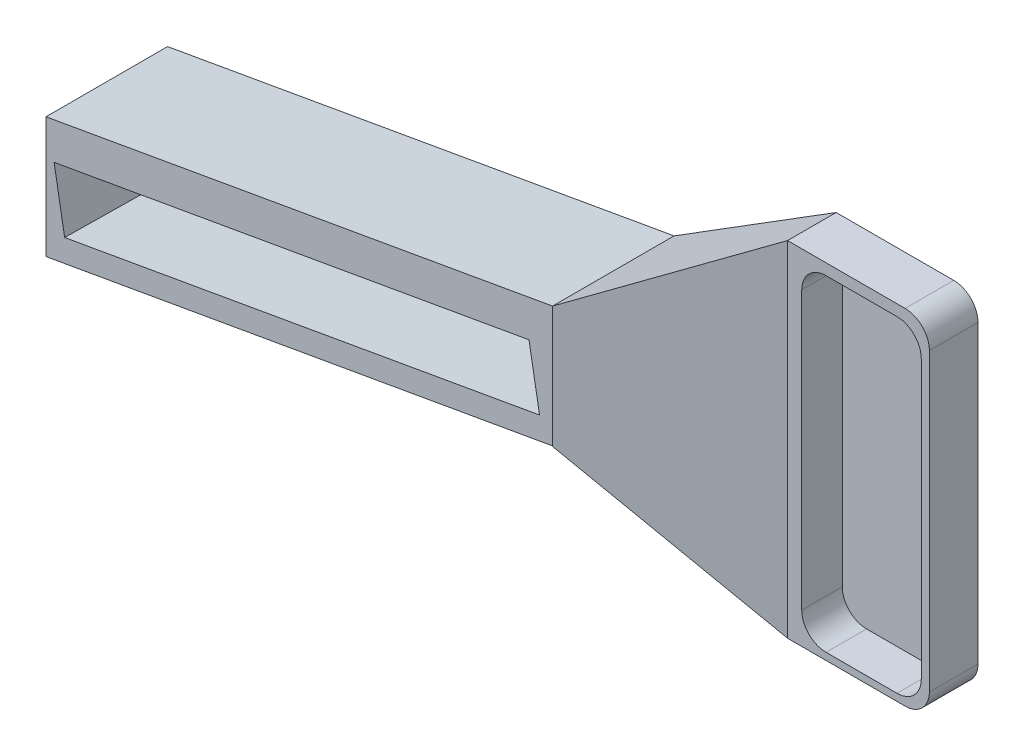
from build123d import *

# Parameters (mm, degrees)
ESQUISSE1_W              = 200
ESQUISSE1_H              = 85
BOSS_EXTRU_1_DEPTH       = 30
ENL_V_MAT_EXTRU_3_DEPTH  = 28
ESQUISSE3_W              = 35
ESQUISSE3_H              = 85
ENL_V_MAT_EXTRU_4_DEPTH  = 18
ESQUISSE4_W              = 29.5
ESQUISSE4_H              = 80.5
ENL_V_MAT_EXTRU_5_DEPTH  = 10
CHANFREIN1_SIZE2         = 40
CHANFREIN1_SIZE          = 18
ENL_V_MAT_EXTRU_18_DEPTH = 220.374109685
ENL_V_MAT_EXTRU_19_DEPTH = 220.374109685
CHANFREIN5_SIZE2         = 30
CHANFREIN5_SIZE          = 40
CHANFREIN6_SIZE2         = 25
CHANFREIN6_SIZE          = 40
ESQUISSE10_W             = 40
ESQUISSE10_H             = 2
ENL_V_MAT_EXTRU_20_DEPTH = 2
ENL_V_MAT_EXTRU_21_DEPTH = 4
CONG_6_R                 = 6
CONG_7_R                 = 6
CHANFREIN7_SIZE2         = 119
CHANFREIN7_SIZE          = 2
CHANFREIN8_SIZE          = 0.47
CHANFREIN8_SIZE_2        = 28


# Some blends are built 0.0001 mm under size
with BuildPart() as part:
    # Esquisse1 → Boss.-Extru.1 (new body)
    with BuildSketch(Plane.XY):
        with Locations((100, 42.5)):
            Rectangle(ESQUISSE1_W, ESQUISSE1_H)
    extrude(amount=BOSS_EXTRU_1_DEPTH)

    # Esquisse2 → Enlèv. mat.-Extru.3 (cut)
    with BuildSketch(Plane.XY.offset(30)):
        Polygon((119.192122608, 49.886058148), (121.796845273, 35.113941852), (4.604722665, 14.44980871), (2, 29.221925005), align=None)
    extrude(amount=-ENL_V_MAT_EXTRU_3_DEPTH, mode=Mode.SUBTRACT)

    # Esquisse3 → Enlèv. mat.-Extru.4 (cut)
    with BuildSketch(Plane.XY.offset(30)):
        with Locations((182.5, 42.5)):
            Rectangle(ESQUISSE3_W, ESQUISSE3_H)
    extrude(amount=-ENL_V_MAT_EXTRU_4_DEPTH, mode=Mode.SUBTRACT)

    # Esquisse4 → Enlèv. mat.-Extru.5 (cut)
    with BuildSketch(Plane.XY.offset(12)):
        with Locations((183.25, 42)):
            Rectangle(ESQUISSE4_W, ESQUISSE4_H)
    extrude(amount=-ENL_V_MAT_EXTRU_5_DEPTH, mode=Mode.SUBTRACT)

    # Chanfrein1
    chanfrein1_edges = [part.edges().sort_by_distance(p)[0] for p in [
        (165, 42.5, 30),
    ]]
    chanfrein1_side = [part.faces().sort_by_distance(p)[0] for p in [
        (165, 42.5, 29.64),
    ]]
    chamfer(chanfrein1_edges, length=CHANFREIN1_SIZE - 0.0001, length2=CHANFREIN1_SIZE2 - 0.0001, reference=chanfrein1_side[0])  # a hair under: the kernel refuses the full size

    # Esquisse7 → Enlèv. mat.-Extru.18 (cut, through all)
    with BuildSketch(Plane.XY.offset(30)):
        Polygon((0, 37.959127411), (125, 60), (125, 85), (0, 85), align=None)
    extrude(amount=-ENL_V_MAT_EXTRU_18_DEPTH, mode=Mode.SUBTRACT)

    # Esquisse9 → Enlèv. mat.-Extru.19 (cut, through all)
    with BuildSketch(Plane.XY.offset(30)):
        Polygon((125, 30.113941852), (0, 8.073069264), (0, 0), (125, 0), align=None)
    extrude(amount=-ENL_V_MAT_EXTRU_19_DEPTH, mode=Mode.SUBTRACT)

    # Chanfrein5
    chanfrein5_edges = [part.edges().sort_by_distance(p)[0] for p in [
        (125, 0, 15),
    ]]
    chanfrein5_side = [part.faces().sort_by_distance(p)[0] for p in [
        (125.6, 0, 15),
    ]]
    chamfer(chanfrein5_edges, length=CHANFREIN5_SIZE - 0.0001, length2=CHANFREIN5_SIZE2 - 0.0001, reference=chanfrein5_side[0])  # a hair under: the kernel refuses the full size

    # Chanfrein6
    chanfrein6_edges = [part.edges().sort_by_distance(p)[0] for p in [
        (125, 85, 15),
    ]]
    chanfrein6_side = [part.faces().sort_by_distance(p)[0] for p in [
        (125.5, 85, 15),
    ]]
    chamfer(chanfrein6_edges, length=CHANFREIN6_SIZE - 0.0001, length2=CHANFREIN6_SIZE2 - 0.0001, reference=chanfrein6_side[0])  # a hair under: the kernel refuses the full size

    # Esquisse10 → Enlèv. mat.-Extru.20 (cut)
    with BuildSketch(Plane(origin=(-1.380576153, 7.829636439, 0), x_dir=(0.9848077530122079, 0.17364817766693122, 0), z_dir=(0.17364817766693122, -0.9848077530122079, 0))):
        with Locations((26.401873766, 3)):
            Rectangle(ESQUISSE10_W, ESQUISSE10_H)
    extrude(amount=-ENL_V_MAT_EXTRU_20_DEPTH, mode=Mode.SUBTRACT)

    # Esquisse11 → Enlèv. mat.-Extru.21 (cut)
    with BuildSketch(Plane(origin=(0, 0, 0), x_dir=(-1, 0, 0), z_dir=(0, 0, -1))):
        Polygon((-5, 10.985557391), (-44.39231012, 17.931484498), (-44.045013765, 19.901100004), (-4.652703645, 12.955172897), align=None)
    extrude(amount=-ENL_V_MAT_EXTRU_21_DEPTH, mode=Mode.SUBTRACT)

    # Congé6
    cong_6_edges = [part.edges().sort_by_distance(p)[0] for p in [
        (198, 82.25, 7),
        (198, 1.75, 7),
        (168.5, 1.75, 7),
        (168.5, 82.25, 7),
    ]]
    fillet(cong_6_edges, radius=CONG_6_R)

    # Congé7
    cong_7_edges = [part.edges().sort_by_distance(p)[0] for p in [
        (200, 85, 6),
        (200, 0, 6),
    ]]
    fillet(cong_7_edges, radius=CONG_7_R)

    # Chanfrein7
    chanfrein7_edges = [part.edges().sort_by_distance(p)[0] for p in [
        (120.494483941, 42.5, 2),
    ]]
    chanfrein7_side = [part.faces().sort_by_distance(p)[0] for p in [
        (120.494483941, 42.5, 2.04),
    ]]
    chamfer(chanfrein7_edges, length=CHANFREIN7_SIZE - 0.0001, length2=CHANFREIN7_SIZE2 - 0.0001, reference=chanfrein7_side[0])  # a hair under: the kernel refuses the full size

    # Chanfrein8
    # the kernel refuses this chamfer: 28, 0.47 mm, written as the material it adds along each edge
    with BuildSketch(Plane(origin=(17.246244149, -57.243822257, 2), x_dir=(0.3939624540892155, 0.06946621004204875, -0.9164976979951431), z_dir=(-0.1736481776669307, 0.984807753012208, 0))) as chanfrein8_piece_1_section:
        Polygon((CHANFREIN8_SIZE * 0.400039959966, -CHANFREIN8_SIZE * 0.916497697995), (-CHANFREIN8_SIZE_2 * 0.916497697995, -CHANFREIN8_SIZE_2 * 0.400039959966), (0, 0), align=None)
    chanfrein8_piece_1 = extrude(amount=160.599241573, mode=Mode.PRIVATE)
    chanfrein8_piece_1 = split(chanfrein8_piece_1, bisect_by=Plane(origin=(0.668634618, 38.077025735, 2.989674186), z_dir=(0.17364817766693805, -0.9848077530122068, 0)), keep=Keep.TOP, mode=Mode.PRIVATE)
    chanfrein8_piece_1 = split(chanfrein8_piece_1, bisect_by=Plane(origin=(5.084858853, 13.03137352, 2.989674186), z_dir=(-0.17364817766693125, 0.9848077530122079, 0)), keep=Keep.TOP, mode=Mode.PRIVATE)
    add(chanfrein8_piece_1)


solid = part.part
